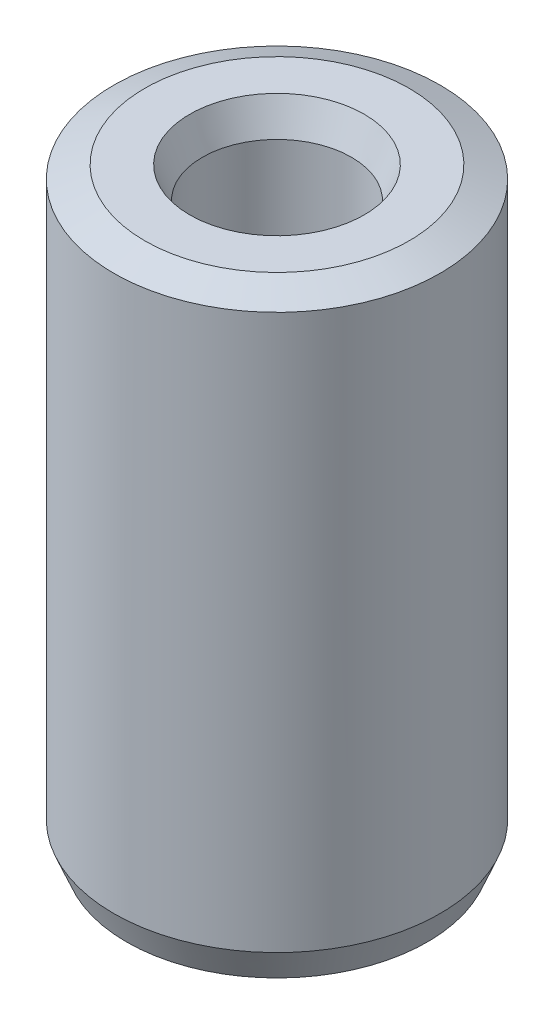
from build123d import *
from OCP.BRepFilletAPI import BRepFilletAPI_MakeChamfer

# Parameters (mm, degrees)
SKETCH1_R           = 50
BOSS_EXTRUDE1_DEPTH = 183.32409976
SKETCH2_R           = 22.862843936
CUT_EXTRUDE1_DEPTH  = 197.488487075
CHAMFER1_SIZE       = 3.881882847
CHAMFER1_SIZE2      = 9.486015797


with BuildPart() as part:
    # Sketch1 → Boss-Extrude1 (new body)
    with BuildSketch(Plane(origin=(0, 0, 0), x_dir=(1, 0, 0), z_dir=(0, 1, 0))):
        Circle(SKETCH1_R)
    extrude(amount=BOSS_EXTRUDE1_DEPTH)

    # Sketch2 → Cut-Extrude1 (cut, through all)
    with BuildSketch(Plane(origin=(0, 0, 0), x_dir=(1, 0, 0), z_dir=(0, 1, 0))):
        Circle(SKETCH2_R)
    extrude(amount=CUT_EXTRUDE1_DEPTH, mode=Mode.SUBTRACT)

    # Chamfer1: one chamfer whose edges measure the first distance from different faces: ONE call of the kernel's chamfer builder (chamfer() names one face for all edges)
    chamfer1_edges_1 = [part.edges().sort_by_distance(p)[0] for p in [
        (-22.862843936, 183.32409976, 0),
    ]]
    chamfer1_side_1 = [part.faces().sort_by_distance(p)[0] for p in [
        (-48.585786438, 183.32409976, 0),
    ]]
    chamfer1_edges_2 = [part.edges().sort_by_distance(p)[0] for p in [
        (-22.862843936, 0, 0),
    ]]
    chamfer1_side_2 = [part.faces().sort_by_distance(p)[0] for p in [
        (-22.862843936, 91.66204988, 0),
    ]]
    chamfer1_edges_3 = [part.edges().sort_by_distance(p)[0] for p in [
        (-50, 0, 0),
    ]]
    chamfer1_side_3 = [part.faces().sort_by_distance(p)[0] for p in [
        (-48.585786438, 0, 0),
    ]]
    chamfer1_edges_4 = [part.edges().sort_by_distance(p)[0] for p in [
        (-50, 183.32409976, 0),
    ]]
    chamfer1_side_4 = [part.faces().sort_by_distance(p)[0] for p in [
        (-50, 91.66204988, 0),
    ]]
    chamfer1 = BRepFilletAPI_MakeChamfer(part.part.solid().wrapped)
    for e in chamfer1_edges_1:
        chamfer1.Add(CHAMFER1_SIZE, CHAMFER1_SIZE2, e.wrapped, chamfer1_side_1[0].wrapped)  # the first distance lies on this face
    for e in chamfer1_edges_2:
        chamfer1.Add(CHAMFER1_SIZE, CHAMFER1_SIZE2, e.wrapped, chamfer1_side_2[0].wrapped)  # the first distance lies on this face
    for e in chamfer1_edges_3:
        chamfer1.Add(CHAMFER1_SIZE, CHAMFER1_SIZE2, e.wrapped, chamfer1_side_3[0].wrapped)  # the first distance lies on this face
    for e in chamfer1_edges_4:
        chamfer1.Add(CHAMFER1_SIZE, CHAMFER1_SIZE2, e.wrapped, chamfer1_side_4[0].wrapped)  # the first distance lies on this face
    add(Compound.cast(chamfer1.Shape()), mode=Mode.REPLACE)


solid = part.part
